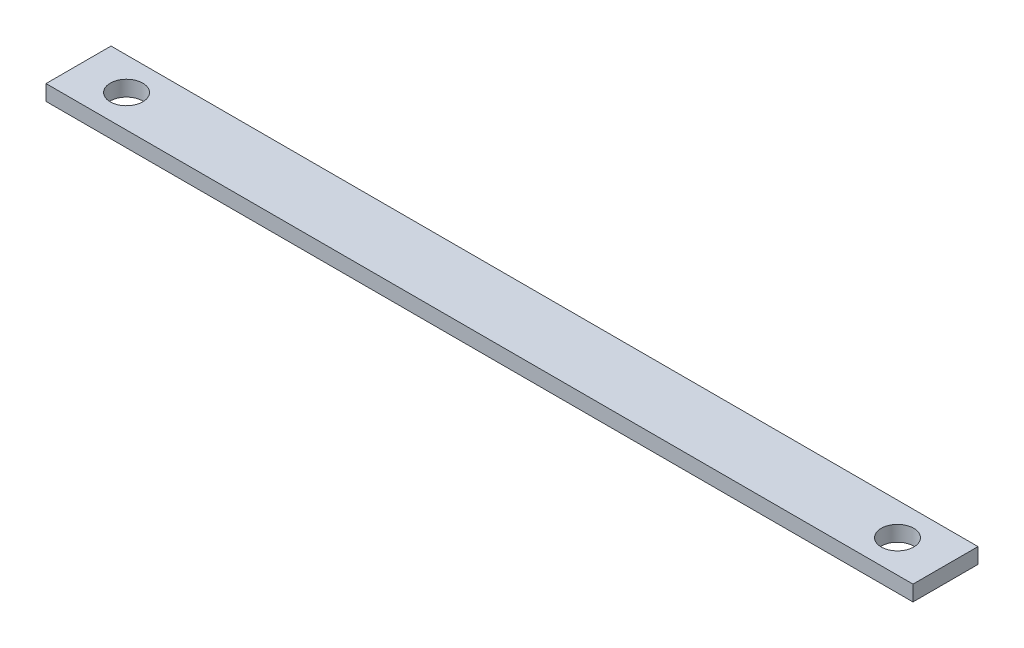
from build123d import *

# Parameters (mm, degrees)
ESQUISSE1_W             = 560
ESQUISSE1_H             = 42
BOSS_EXTRU_1_DEPTH      = 10
ESQUISSE2_R             = 10.5
ENL_V_MAT_EXTRU_1_DEPTH = 20


with BuildPart() as part:
    # Esquisse1 → Boss.-Extru.1 (new body)
    with BuildSketch(Plane(origin=(0, 0, 0), x_dir=(1, 0, 0), z_dir=(0, 1, 0))):
        Rectangle(ESQUISSE1_W, ESQUISSE1_H)
    extrude(amount=BOSS_EXTRU_1_DEPTH)

    # Esquisse2 → Enlèv. mat.-Extru.1 (cut)
    with BuildSketch(Plane(origin=(0, 10, 0), x_dir=(1, 0, 0), z_dir=(0, 1, 0))):
        with Locations((249, 0)):
            Circle(ESQUISSE2_R)
        with Locations((-249, 0)):
            Circle(ESQUISSE2_R)
    extrude(amount=-ENL_V_MAT_EXTRU_1_DEPTH, mode=Mode.SUBTRACT)


solid = part.part
